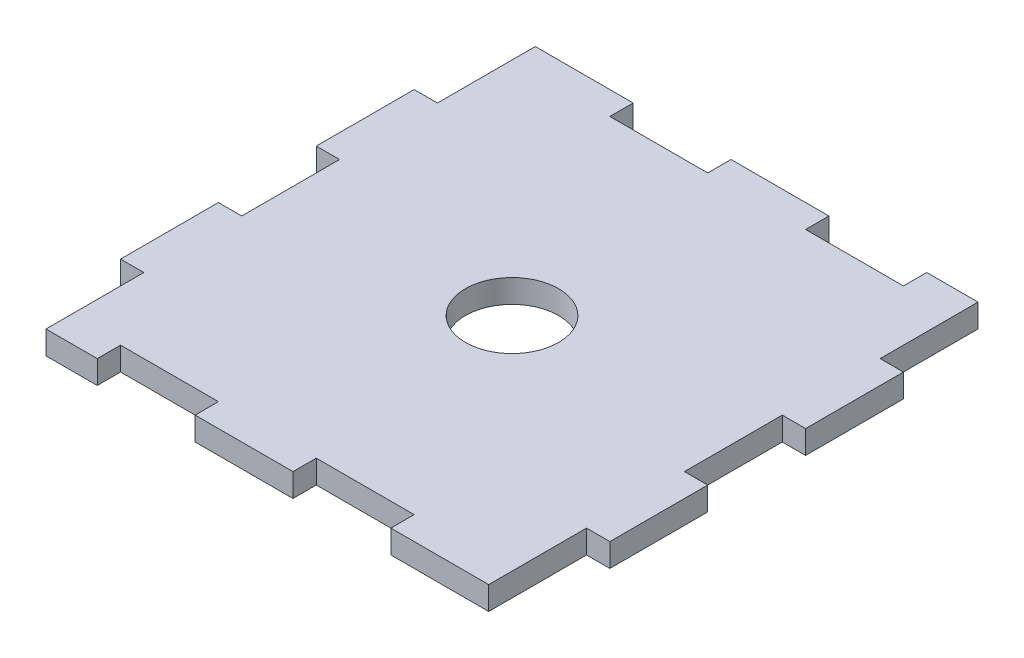
from build123d import *

# Parameters (mm, degrees)
BOSS_EXTRUDE1_DEPTH = 4.7625
SKETCH3_R           = 9.525
CUT_EXTRUDE1_DEPTH  = 4.7625


with BuildPart() as part:
    # Sketch2 → Boss-Extrude1 (new body)
    with BuildSketch(Plane(origin=(0, 100, 0), x_dir=(1, 0, 0), z_dir=(0, 1, 0))):
        Polygon((40, 100), (40, 95.2375), (20, 95.2375), (20, 100), (0, 100), (0, 80), (-4.7625, 80), (-4.7625, 60), (0, 60), (0, 40), (-4.7625, 40), (-4.7625, 20), (0, 20), (0, 0), (10.475, 0), (10.475, 4.7625), (30.475, 4.7625), (30.475, 0), (50.475, 0), (50.475, 4.7625), (70.475, 4.7625), (70.475, 0), (90.475, 0), (90.475, 20), (95.2375, 20), (95.2375, 40), (90.475, 40), (90.475, 60), (95.2375, 60), (95.2375, 80), (90.475, 80), (90.475, 100), (80, 100), (80, 95.2375), (60, 95.2375), (60, 100), align=None)
    extrude(amount=-BOSS_EXTRUDE1_DEPTH)

    # Sketch3 → Cut-Extrude1 (cut)
    with BuildSketch(Plane(origin=(0, 100, 0), x_dir=(1, 0, 0), z_dir=(0, 1, 0))):
        with Locations((45.2375, 50)):
            Circle(SKETCH3_R)
    extrude(amount=-CUT_EXTRUDE1_DEPTH, mode=Mode.SUBTRACT)


solid = part.part
